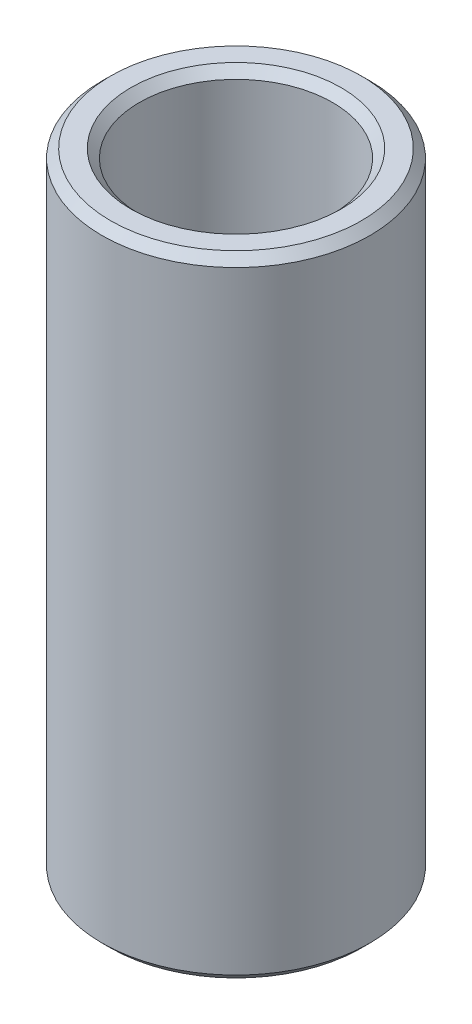
from build123d import *

# Parameters (mm, degrees)
SKETCH1_R           = 47.5
BOSS_EXTRUDE1_DEPTH = 223.31037629
SKETCH2_R           = 34.25977672
CUT_EXTRUDE1_DEPTH  = 234.195249006
CHAMFER1_SIZE       = 3.034872243


with BuildPart() as part:
    # Sketch1 → Boss-Extrude1 (new body)
    with BuildSketch(Plane(origin=(0, 0, 0), x_dir=(1, 0, 0), z_dir=(0, 1, 0))):
        Circle(SKETCH1_R)
    extrude(amount=BOSS_EXTRUDE1_DEPTH)

    # Sketch2 → Cut-Extrude1 (cut, through all)
    with BuildSketch(Plane(origin=(0, 0, 0), x_dir=(1, 0, 0), z_dir=(0, 1, 0))):
        Circle(SKETCH2_R)
    extrude(amount=CUT_EXTRUDE1_DEPTH, mode=Mode.SUBTRACT)

    # Chamfer1
    chamfer1_edges = [part.edges().sort_by_distance(p)[0] for p in [
        (-34.25977672, 223.31037629, 0),
        (-34.25977672, 0, 0),
        (-47.5, 0, 0),
        (-47.5, 223.31037629, 0),
    ]]
    chamfer(chamfer1_edges, length=CHAMFER1_SIZE)


solid = part.part
